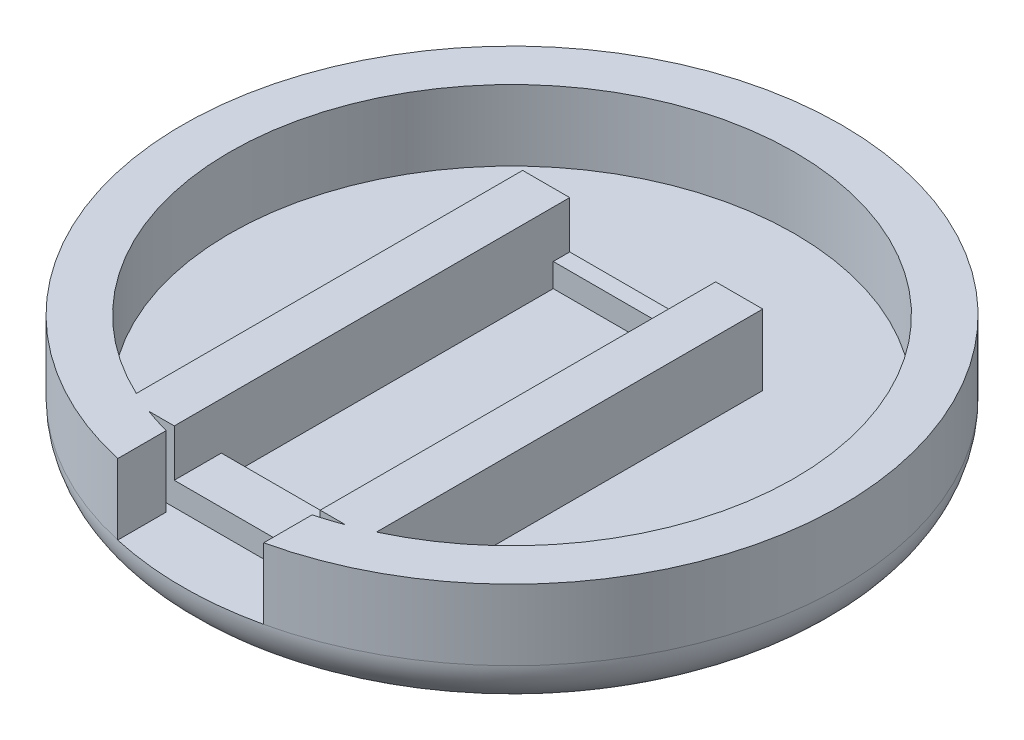
from build123d import *

# Parameters (mm, degrees)
SKETCH1_W           = 10.2
SKETCH1_H           = 16.8
SKETCH1_W_2         = 6.2
SKETCH1_H_2         = 14.1
BOSS_EXTRUDE1_DEPTH = 3
SKETCH2_W           = 6.2
SKETCH2_H           = 2
CUT_EXTRUDE1_DEPTH  = 25.4
SKETCH3_W           = 10.2
SKETCH3_H           = 16.8
BOSS_EXTRUDE2_DEPTH = 2
SKETCH4_R           = 14
SKETCH4_R_2         = 12
BOSS_EXTRUDE4_DEPTH = 5
SKETCH5_R           = 14
BOSS_EXTRUDE5_DEPTH = 2
SKETCH6_W           = 6.2
SKETCH6_H           = 3
CUT_EXTRUDE2_DEPTH  = 7.62


with BuildPart() as part:
    # Sketch1 → Boss-Extrude1 (new body)
    with BuildSketch(Plane(origin=(0, 0, 0), x_dir=(1, 0, 0), z_dir=(0, 1, 0))):
        with Locations((-29.627149571, -6.071905286)):
            Rectangle(SKETCH1_W, SKETCH1_H)
        with Locations((-29.627149571, -5.421905286)):
            Rectangle(SKETCH1_W_2, SKETCH1_H_2, mode=Mode.SUBTRACT)
    extrude(amount=BOSS_EXTRUDE1_DEPTH)

    # Sketch2 → Cut-Extrude1 (cut)
    with BuildSketch(Plane.XY.offset(14.471905286)):
        with Locations((-29.627149571, 2)):
            Rectangle(SKETCH2_W, SKETCH2_H)
    extrude(amount=-CUT_EXTRUDE1_DEPTH, mode=Mode.SUBTRACT)

    # Sketch3 → Boss-Extrude2 (add)
    with BuildSketch(Plane.XZ):
        with Locations((-29.627149571, 6.071905286)):
            Rectangle(SKETCH3_W, SKETCH3_H)
    extrude(amount=BOSS_EXTRUDE2_DEPTH)

    # Sketch4 → Boss-Extrude4 (add)
    with BuildSketch(Plane.XZ.offset(2)):
        with Locations(Location((-29.627149571, 3.222245286, 0), (0, 0, 270))):
            Circle(SKETCH4_R)
        with Locations((-29.627149571, 3.222245286)):
            Circle(SKETCH4_R_2, mode=Mode.SUBTRACT)
    extrude(amount=-BOSS_EXTRUDE4_DEPTH)

    # Sketch5 → Boss-Extrude5 (add)
    with BuildSketch(Plane.XZ.offset(2)):
        with Locations(Location((-29.627149571, 3.222245286, 0), (0, 0, 270))):
            Circle(SKETCH5_R)
    extrude(amount=-BOSS_EXTRUDE5_DEPTH)

    # Sketch6 → Cut-Extrude2 (cut)
    with BuildSketch(Plane.XY.offset(14.471905286)):
        with Locations((-29.627149571, 1.5)):
            Rectangle(SKETCH6_W, SKETCH6_H)
    extrude(amount=CUT_EXTRUDE2_DEPTH, mode=Mode.SUBTRACT)

    # Fillet2: read off the stored shape, not the designer's step
    # Fillet2 outline → Fillet2 (revolve, cut)
    with BuildSketch(Plane(origin=(-29.627149571, 0, 3.222245286), x_dir=(1, 0, 0), z_dir=(0, 0, 1))):
        with BuildLine():
            Line((14, -2), (14, 0))
            ThreePointArc((14, 0), (13.414213562, -1.414213562), (12, -2))
            Line((12, -2), (14, -2))
        make_face()
    revolve(axis=Axis((-29.627149571, 0, 3.222245286), (0, 1, 0)), mode=Mode.SUBTRACT)


solid = part.part
